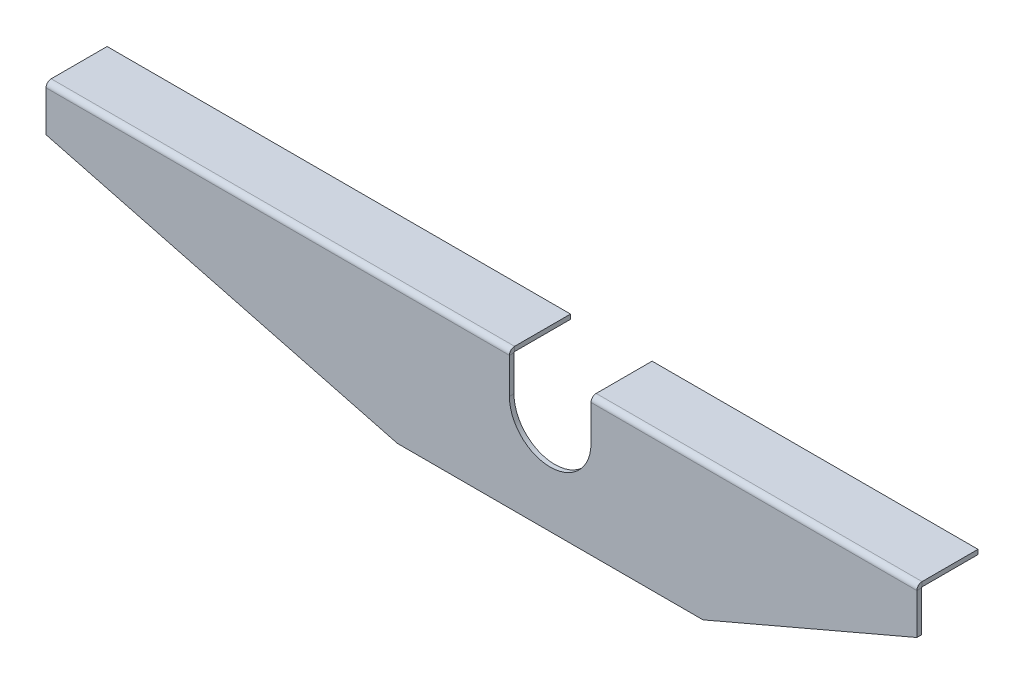
from build123d import *

# Parameters (mm, degrees)
BASE_FLANGE1_DEPTH             = 1.5
EDGE_FLANGE1_STRIP_W           = 6.4
EDGE_FLANGE1_STRIP_H           = 1.5
EDGE_FLANGE1_STRIP_CUT_DEPTH   = 151.65
EDGE_FLANGE1_STRIP_2_W         = 6.4
EDGE_FLANGE1_STRIP_2_H         = 1.5
EDGE_FLANGE1_STRIP_CUT_2_DEPTH = 106.65
EDGE_FLANGE1_DEPTH             = 151.65
EDGE_FLANGE1_BEND_DEPTH        = 106.65


# Sheet-metal steps are written as plain solids
with BuildPart() as part:
    # Sketch1 → Base-Flange1 (new body)
    with BuildSketch(Plane.XY):
        with BuildLine():
            Line((13.35, 0), (13.35, 13.35))
            Line((13.35, 13.35), (120, 13.35))
            Line((120, 13.35), (120, -1.65))
            Line((120, -1.65), (50, -31.65))
            Line((50, -31.65), (-50, -31.65))
            Line((-50, -31.65), (-165, -1.65))
            Line((-165, -1.65), (-165, 13.35))
            Line((-165, 13.35), (-13.35, 13.35))
            Line((-13.35, 13.35), (-13.35, 0))
            ThreePointArc((-13.35, 0), (0, -13.35), (13.35, 0))
        make_face()
    extrude(amount=-BASE_FLANGE1_DEPTH)

    # Edge-Flange1 strip (across the edge) → Edge-Flange1 strip cut (cut)
    with BuildSketch(Plane(origin=(-165, 13.35, -1.5), x_dir=(0, -1, 0), z_dir=(1, 0, 0))):
        with Locations((-1.5, -0.75)):
            Rectangle(EDGE_FLANGE1_STRIP_W, EDGE_FLANGE1_STRIP_H)
    extrude(amount=EDGE_FLANGE1_STRIP_CUT_DEPTH, mode=Mode.SUBTRACT)

    # Edge-Flange1 strip 2 (across the edge) → Edge-Flange1 strip cut 2 (cut)
    with BuildSketch(Plane(origin=(13.35, 13.35, -1.5), x_dir=(0, -1, 0), z_dir=(1, 0, 0))):
        with Locations((-1.5, -0.75)):
            Rectangle(EDGE_FLANGE1_STRIP_2_W, EDGE_FLANGE1_STRIP_2_H)
    extrude(amount=EDGE_FLANGE1_STRIP_CUT_2_DEPTH, mode=Mode.SUBTRACT)

    # Edge-Flange1 section (across the edge) → Edge-Flange1 (add)
    with BuildSketch(Plane(origin=(-165, 13.35, -1.5), x_dir=(0, -1, 0), z_dir=(1, 0, 0))):
        with BuildLine():
            Line((0, 0.2), (0, 18.5))
            Line((0, 18.5), (1.5, 18.5))
            Line((1.5, 18.5), (1.5, 0.2))
            ThreePointArc((1.5, 0.2), (1.558578644, 0.058578644), (1.7, 0))
            Line((1.7, 0), (1.7, -1.5))
            ThreePointArc((1.7, -1.5), (0.497918472, -1.002081528), (0, 0.2))
        make_face()
    extrude(amount=EDGE_FLANGE1_DEPTH)

    # Edge-Flange1 section 2 (across the edge) → Edge-Flange1 bend (add)
    with BuildSketch(Plane(origin=(13.35, 13.35, -1.5), x_dir=(0, -1, 0), z_dir=(1, 0, 0))):
        with BuildLine():
            Line((0, 0.2), (0, 18.5))
            Line((0, 18.5), (1.5, 18.5))
            Line((1.5, 18.5), (1.5, 0.2))
            ThreePointArc((1.5, 0.2), (1.558578644, 0.058578644), (1.7, 0))
            Line((1.7, 0), (1.7, -1.5))
            ThreePointArc((1.7, -1.5), (0.497918472, -1.002081528), (0, 0.2))
        make_face()
    extrude(amount=EDGE_FLANGE1_BEND_DEPTH)


solid = part.part
